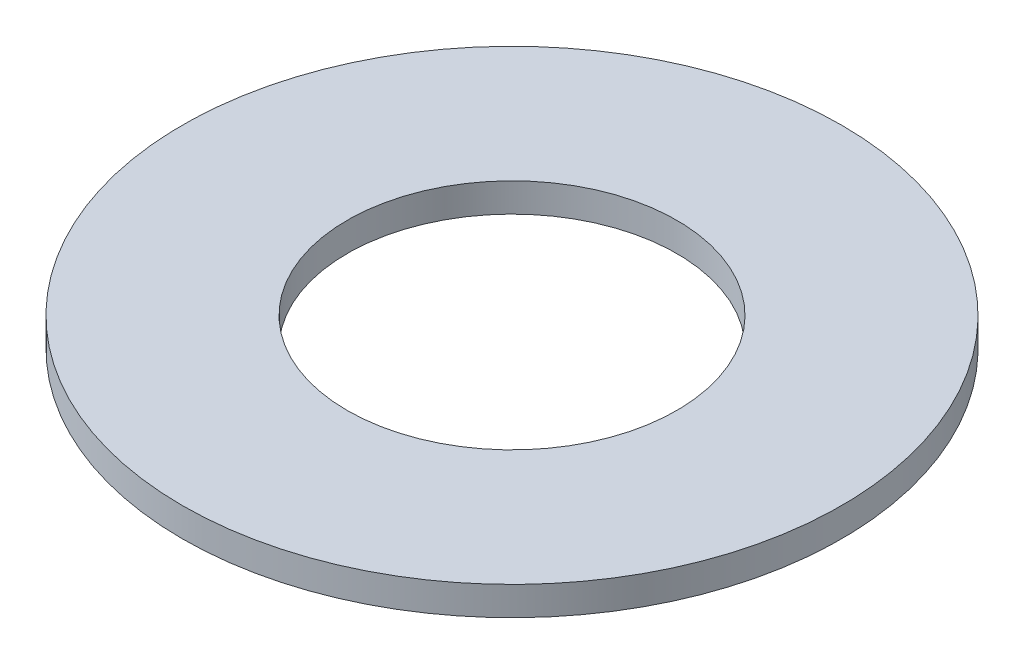
from build123d import *

# Parameters (mm, degrees)
SKETCH1_R           = 80
BOSS_EXTRUDE1_DEPTH = 7
SKETCH2_R           = 40
CUT_EXTRUDE1_DEPTH  = 114.353429591


with BuildPart() as part:
    # Sketch1 → Boss-Extrude1 (new body)
    with BuildSketch(Plane(origin=(0, 0, 0), x_dir=(1, 0, 0), z_dir=(0, 1, 0))):
        Circle(SKETCH1_R)
    extrude(amount=BOSS_EXTRUDE1_DEPTH)

    # Sketch2 → Cut-Extrude1 (cut, through all)
    with BuildSketch(Plane(origin=(0, 0, 0), x_dir=(1, 0, 0), z_dir=(0, 1, 0))):
        Circle(SKETCH2_R)
    extrude(amount=CUT_EXTRUDE1_DEPTH, mode=Mode.SUBTRACT)


solid = part.part
